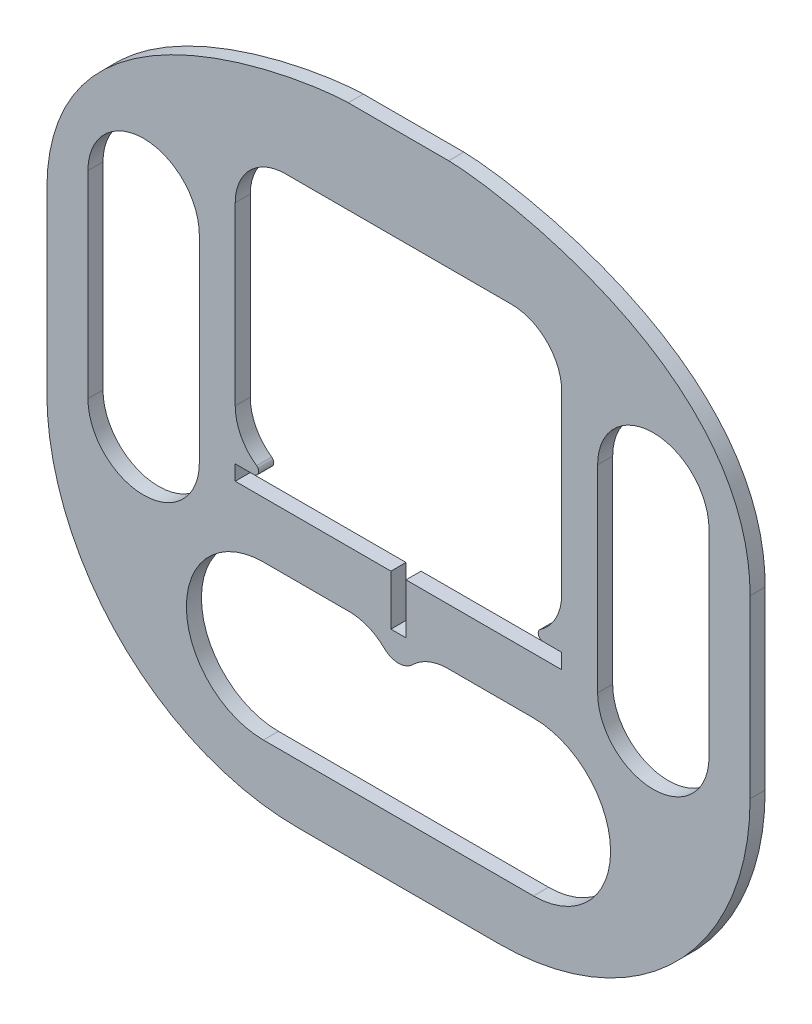
from build123d import *

# Parameters (mm, degrees)
BOSS_EXTRUDE1_DEPTH = 3
CUT_EXTRUDE1_DEPTH  = 10
SKETCH3_W           = 65
SKETCH3_H           = 3
CUT_EXTRUDE2_DEPTH  = 10
FILLET1_START       = -1
FILLET1_DEPTH       = 5
SKETCH4_W           = 3
SKETCH4_H           = 10
CUT_EXTRUDE3_DEPTH  = 10
BOSS_EXTRUDE2_DEPTH = 3
FILLET2_R           = 10


with BuildPart() as part:
    # Sketch1 → Boss-Extrude1 (new body)
    with BuildSketch(Plane.XY):
        with BuildLine():
            add(Edge.make_bspline(
                [(-70, -11.5), (-70, 26.5), (-18, 33.5), (-10, 33.5)],
                knots=[0, 0, 0, 0, 1, 1, 1, 1], degree=3))
            Line((-70, -11.5), (-70, -46.5))
            ThreePointArc((-70, -46.5), (-55.355339059, -81.855339059), (-20, -96.5))
            Line((-20, -96.5), (20, -96.5))
            ThreePointArc((20, -96.5), (55.355339059, -81.855339059), (70, -46.5))
            Line((70, -46.5), (70, -11.5))
            add(Edge.make_bspline(
                [(10, 33.5), (18, 33.5), (70, 26.5), (70, -11.5)],
                knots=[0, 0, 0, 0, 1, 1, 1, 1], degree=3))
            Line((10, 33.5), (-10, 33.5))
        make_face()
    extrude(amount=BOSS_EXTRUDE1_DEPTH)

    # Sketch2 → Cut-Extrude1 (cut)
    with BuildSketch(Plane.XY.offset(3)):
        with BuildLine():
            Line((-22.5, -40), (22.5, -40))
            ThreePointArc((22.5, -40), (29.571067812, -37.071067812), (32.5, -30))
            Line((32.5, -30), (32.5, 5))
            ThreePointArc((32.5, 5), (29.571067812, 12.071067812), (22.5, 15))
            Line((22.5, 15), (-22.5, 15))
            ThreePointArc((-22.5, 15), (-29.571067812, 12.071067812), (-32.5, 5))
            Line((-32.5, 5), (-32.5, -30))
            ThreePointArc((-32.5, -30), (-29.571067812, -37.071067812), (-22.5, -40))
        make_face()
    extrude(amount=-CUT_EXTRUDE1_DEPTH, mode=Mode.SUBTRACT)

    # Sketch3 → Cut-Extrude2 (cut)
    with BuildSketch(Plane.XY.offset(3)):
        with Locations((0, -41.5)):
            Rectangle(SKETCH3_W, SKETCH3_H)
        with BuildLine():
            Line((-26.880912438, -54.126379534), (26.880912438, -54.126379534))
            ThreePointArc((26.880912438, -54.126379534), (42.22301594, -69.468483036), (26.880912438, -84.810586538))
            Line((26.880912438, -84.810586538), (-26.880912438, -84.810586538))
            ThreePointArc((-26.880912438, -84.810586538), (-42.22301594, -69.468483036), (-26.880912438, -54.126379534))
        make_face()
        with BuildLine():
            Line((-39.64451115, -4.103386604), (-39.64451115, -43.425584655))
            ThreePointArc((-39.64451115, -43.425584655), (-50.732081748, -54.513155253), (-61.819652346, -43.425584655))
            Line((-61.819652346, -43.425584655), (-61.819652346, -4.103386604))
            ThreePointArc((-61.819652346, -4.103386604), (-50.732081748, 6.984183994), (-39.64451115, -4.103386604))
        make_face()
        with BuildLine():
            Line((39.64451115, -4.103386604), (39.64451115, -43.425584655))
            ThreePointArc((39.64451115, -43.425584655), (50.732081748, -54.513155253), (61.819652346, -43.425584655))
            Line((61.819652346, -43.425584655), (61.819652346, -4.103386604))
            ThreePointArc((61.819652346, -4.103386604), (50.732081748, 6.984183994), (39.64451115, -4.103386604))
        make_face()
    extrude(amount=-CUT_EXTRUDE2_DEPTH, mode=Mode.SUBTRACT)

    # Fillet1: read off the stored shape, not the designer's step
    # Fillet1 outline → Fillet1 (cut)
    with BuildSketch(Plane.XY.offset(FILLET1_START)):
        with BuildLine():
            ThreePointArc((28.82455532, -40), (27.871092731, -39.301511345), (28.249595746, -38.181818182))
            ThreePointArc((28.249595746, -38.181818182), (25.515113446, -39.534625893), (22.5, -40))
            Line((22.5, -40), (28.82455532, -40))
        make_face()
        with BuildLine():
            ThreePointArc((-28.249595746, -38.181818182), (-27.871092731, -39.301511345), (-28.82455532, -40))
            Line((-28.82455532, -40), (-22.5, -40))
            ThreePointArc((-22.5, -40), (-25.515113446, -39.534625893), (-28.249595746, -38.181818182))
        make_face()
    extrude(amount=FILLET1_DEPTH, mode=Mode.SUBTRACT)

    # Sketch4 → Cut-Extrude3 (cut)
    with BuildSketch(Plane.XY.offset(3)):
        with Locations((0, -48)):
            Rectangle(SKETCH4_W, SKETCH4_H)
    extrude(amount=-CUT_EXTRUDE3_DEPTH, mode=Mode.SUBTRACT)

    # Sketch5 → Boss-Extrude2 (add)
    with BuildSketch(Plane.XY.offset(3)):
        with BuildLine():
            Line((-4, -54.126379534), (4, -54.126379534))
            ThreePointArc((4, -54.126379534), (0, -58.126379534), (-4, -54.126379534))
        make_face()
    extrude(amount=-BOSS_EXTRUDE2_DEPTH)

    # Fillet2
    fillet2_edges = [part.edges().sort_by_distance(p)[0] for p in [
        (4, -54.126379534, 1.5),
        (-4, -54.126379534, 1.5),
    ]]
    fillet(fillet2_edges, radius=FILLET2_R)


solid = part.part
